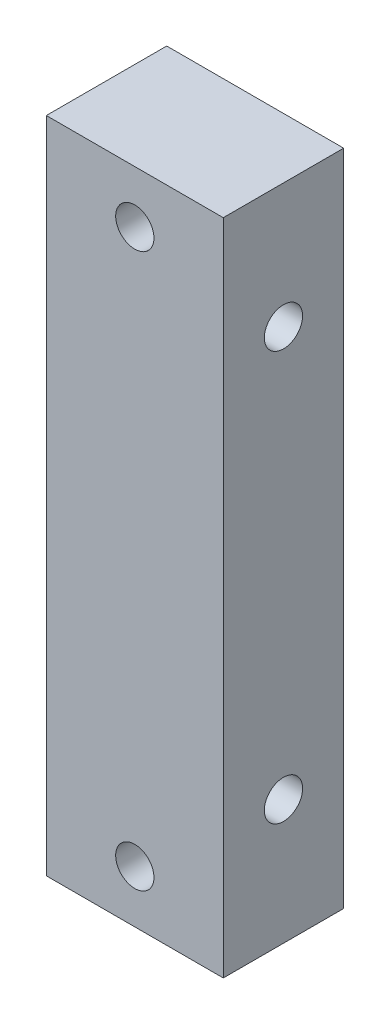
from build123d import *

# Parameters (mm, degrees)
SKETCH1_W                      = 18.669
SKETCH1_H                      = 69.469
BOSS_EXTRUDE1_DEPTH            = 12.7
TAP_DRILL_FOR_10_32_TAP1_D     = 4.0386
TAP_DRILL_FOR_10_32_TAP2_D     = 4.0386
TAP_DRILL_FOR_10_32_TAP2_DEPTH = 6.35
TAP_DRILL_FOR_10_32_TAP2_TIP   = 1.213317848


with BuildPart() as part:
    # Sketch1 → Boss-Extrude1 (new body)
    with BuildSketch(Plane.XY):
        Rectangle(SKETCH1_W, SKETCH1_H)
    extrude(amount=BOSS_EXTRUDE1_DEPTH)

    # Tap Drill for #10-32 Tap1 (through all)
    with Locations(Plane(origin=(9.3345, 0, 0), x_dir=(0, 0, -1), z_dir=(1, 0, 0))):
        with Locations((-6.35, 21.59), (-6.35, -21.59)):
            Hole(TAP_DRILL_FOR_10_32_TAP1_D / 2)

    # Tap Drill for #10-32 Tap2
    with Locations(Plane.XY.offset(12.7)):
        with Locations((0, 29.21), (0, -29.21)):
            Hole(TAP_DRILL_FOR_10_32_TAP2_D / 2, depth=TAP_DRILL_FOR_10_32_TAP2_DEPTH)
            with Locations((0, 0, -(TAP_DRILL_FOR_10_32_TAP2_DEPTH + TAP_DRILL_FOR_10_32_TAP2_TIP / 2))):  # 118° drill point
                Cone(0, TAP_DRILL_FOR_10_32_TAP2_D / 2, TAP_DRILL_FOR_10_32_TAP2_TIP, mode=Mode.SUBTRACT)


solid = part.part
